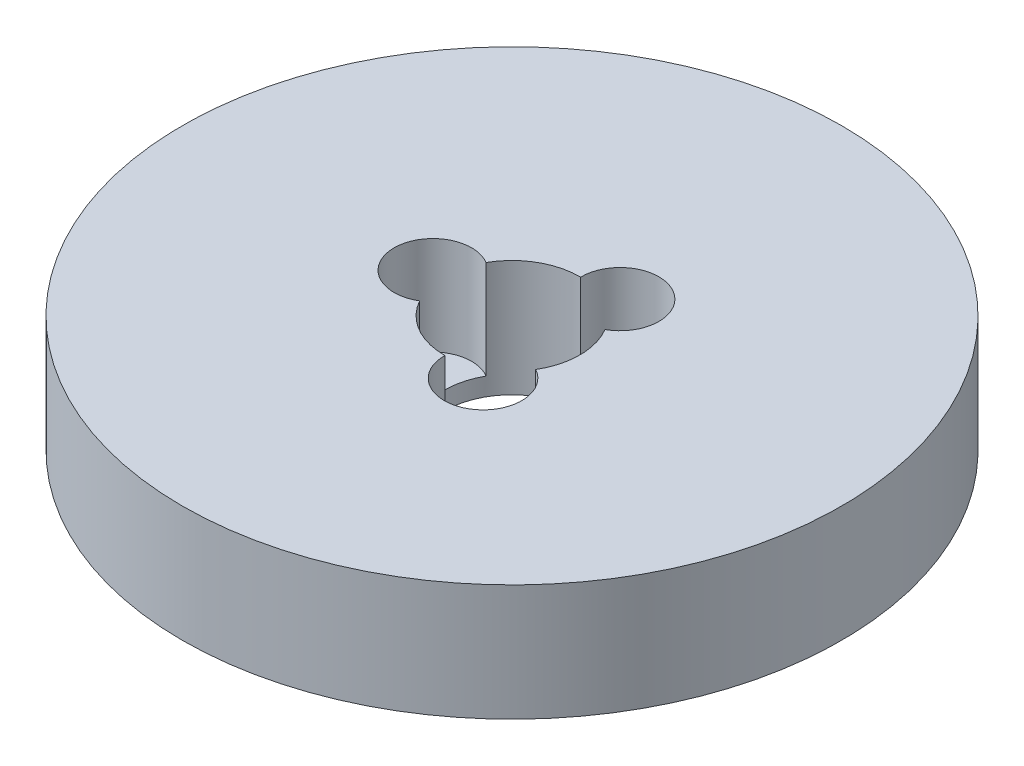
from build123d import *

# Parameters (mm, degrees)
SKETCH1_R           = 85
BOSS_EXTRUDE1_DEPTH = 30
SKETCH2_R           = 17.5
CUT_EXTRUDE1_DEPTH  = 124.895116934
SKETCH3_R           = 10
CUT_EXTRUDE2_DEPTH  = 25.362535038
CIRPATTERN1_COUNT   = 3


with BuildPart() as part:
    # Sketch1 → Boss-Extrude1 (new body)
    with BuildSketch(Plane(origin=(0, 0, 0), x_dir=(1, 0, 0), z_dir=(0, 1, 0))):
        Circle(SKETCH1_R)
    extrude(amount=BOSS_EXTRUDE1_DEPTH)

    # Sketch2 → Cut-Extrude1 (cut, through all)
    with BuildSketch(Plane(origin=(0, 0, 0), x_dir=(1, 0, 0), z_dir=(0, 1, 0))):
        Circle(SKETCH2_R)
    extrude(amount=CUT_EXTRUDE1_DEPTH, mode=Mode.SUBTRACT)

    # Sketch3 → Cut-Extrude2 (cut)
    with BuildSketch(Plane(origin=(0, 30, 0), x_dir=(1, 0, 0), z_dir=(0, 1, 0))):
        with Locations((-20.412067853, 0)):
            Circle(SKETCH3_R)
    cut_extrude2 = extrude(amount=-CUT_EXTRUDE2_DEPTH, mode=Mode.SUBTRACT)

    # CirPattern1: Cut-Extrude2 ×3 about axis
    cirpattern1_axis = Axis((0, 0, 0), (0, 1, 0))
    for i in range(1, CIRPATTERN1_COUNT):
        add(cut_extrude2.rotate(cirpattern1_axis, i * 360 / CIRPATTERN1_COUNT), mode=Mode.SUBTRACT)


solid = part.part
